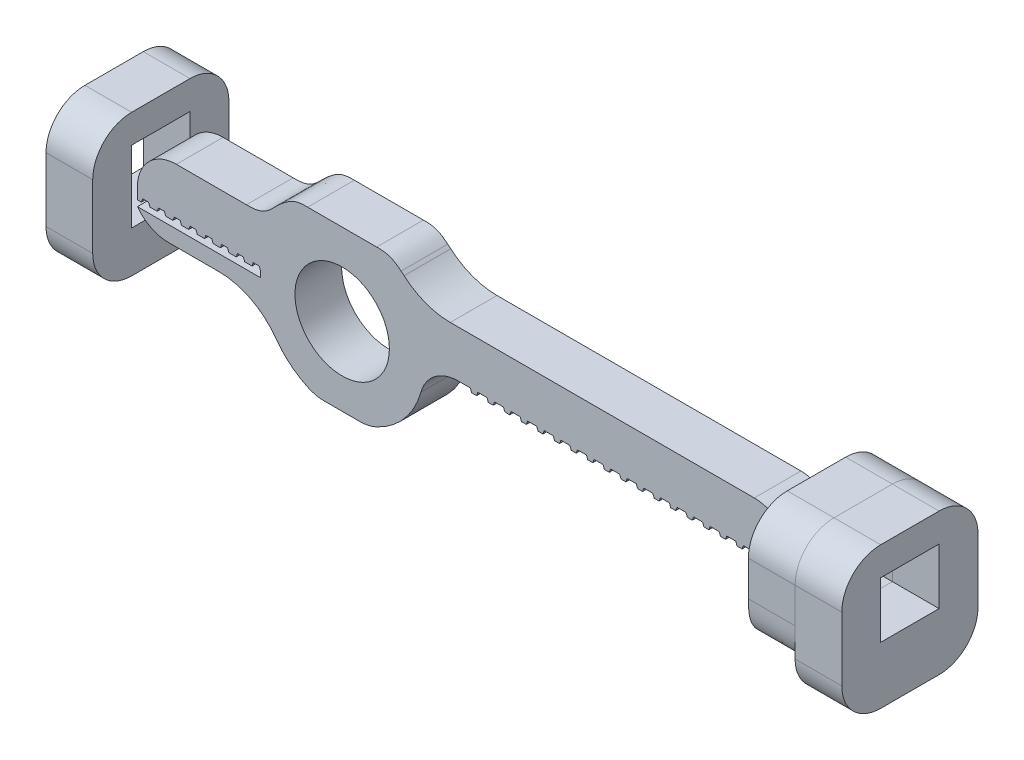
from build123d import *

# Parameters (mm, degrees)
SKETCH1_R      = 6.065
EXTRUDE1_DEPTH = 6
FILLET2_DEPTH  = 6
FILLET3_START  = -1
FILLET3_DEPTH  = 8
FILLET4_START  = -1
FILLET4_DEPTH  = 8
FILLET5_R      = 5
FILLET6_R      = 9
SKETCH2_W      = 17.5
SKETCH2_H      = 14.52
SKETCH2_W_2    = 7.5
SKETCH2_H_2    = 7.19
EXTRUDE2_DEPTH = 6
FILLET7_R      = 5
FILLET8_SIZE   = 5
FILLET9_SIZE   = 5
SKETCH4_W      = 7.5
SKETCH4_H      = 7.19
EXTRUDE4_DEPTH = 6
FILLET10_R     = 5
FILLET11_R     = 5
EXTRUDE5_DEPTH = 6


with BuildPart() as part:
    # Sketch1 → Extrude1 (new body)
    with BuildSketch(Plane.XY):
        with BuildLine():
            Line((-10.493301435, -0.375), (-26.29815405, -0.375))
            Line((-26.29815405, -0.375), (-26.29815405, -2.375))
            Line((-26.29815405, -2.375), (-10.227872457, -2.375))
            ThreePointArc((-10.227872457, -2.375), (-7.721566195, -7.115294477), (-3.201562119, -10))
            Line((-3.201562119, -10), (3.201562119, -10))
            ThreePointArc((3.201562119, -10), (8.720950005, -5.847651752), (10.466746152, 0.835))
            Line((10.466746152, 0.835), (16.466746152, 0.835))
            Line((16.466746152, 0.835), (16.634172459, 0.375))
            Line((16.634172459, 0.375), (17.269319844, 0.375))
            Line((17.269319844, 0.375), (17.436746152, 0.835))
            Line((17.436746152, 0.835), (18.598246152, 0.835))
            Line((18.598246152, 0.835), (18.765672459, 0.375))
            Line((18.765672459, 0.375), (19.400819844, 0.375))
            Line((19.400819844, 0.375), (19.568246152, 0.835))
            Line((19.568246152, 0.835), (20.729746152, 0.835))
            Line((20.729746152, 0.835), (20.897172459, 0.375))
            Line((20.897172459, 0.375), (21.532319844, 0.375))
            Line((21.532319844, 0.375), (21.699746152, 0.835))
            Line((21.699746152, 0.835), (22.861246152, 0.835))
            Line((22.861246152, 0.835), (23.028672459, 0.375))
            Line((23.028672459, 0.375), (23.663819844, 0.375))
            Line((23.663819844, 0.375), (23.831246152, 0.835))
            Line((23.831246152, 0.835), (24.992746152, 0.835))
            Line((24.992746152, 0.835), (25.160172459, 0.375))
            Line((25.160172459, 0.375), (25.795319844, 0.375))
            Line((25.795319844, 0.375), (25.962746152, 0.835))
            Line((25.962746152, 0.835), (27.124246152, 0.835))
            Line((27.124246152, 0.835), (27.291672459, 0.375))
            Line((27.291672459, 0.375), (27.926819844, 0.375))
            Line((27.926819844, 0.375), (28.094246152, 0.835))
            Line((28.094246152, 0.835), (29.255746152, 0.835))
            Line((29.255746152, 0.835), (29.423172459, 0.375))
            Line((29.423172459, 0.375), (30.058319844, 0.375))
            Line((30.058319844, 0.375), (30.225746152, 0.835))
            Line((30.225746152, 0.835), (31.387246152, 0.835))
            Line((31.387246152, 0.835), (31.554672459, 0.375))
            Line((31.554672459, 0.375), (32.189819844, 0.375))
            Line((32.189819844, 0.375), (32.357246152, 0.835))
            Line((32.357246152, 0.835), (33.518746152, 0.835))
            Line((33.518746152, 0.835), (33.686172459, 0.375))
            Line((33.686172459, 0.375), (34.321319844, 0.375))
            Line((34.321319844, 0.375), (34.488746152, 0.835))
            Line((34.488746152, 0.835), (35.650246152, 0.835))
            Line((35.650246152, 0.835), (35.817672459, 0.375))
            Line((35.817672459, 0.375), (36.452819844, 0.375))
            Line((36.452819844, 0.375), (36.620246152, 0.835))
            Line((36.620246152, 0.835), (37.781746152, 0.835))
            Line((37.781746152, 0.835), (37.949172459, 0.375))
            Line((37.949172459, 0.375), (38.584319844, 0.375))
            Line((38.584319844, 0.375), (38.751746152, 0.835))
            Line((38.751746152, 0.835), (39.913246152, 0.835))
            Line((39.913246152, 0.835), (40.080672459, 0.375))
            Line((40.080672459, 0.375), (40.715819844, 0.375))
            Line((40.715819844, 0.375), (40.883246152, 0.835))
            Line((40.883246152, 0.835), (42.044746152, 0.835))
            Line((42.044746152, 0.835), (42.212172459, 0.375))
            Line((42.212172459, 0.375), (42.847319844, 0.375))
            Line((42.847319844, 0.375), (43.014746152, 0.835))
            Line((43.014746152, 0.835), (44.176246152, 0.835))
            Line((44.176246152, 0.835), (44.343672459, 0.375))
            Line((44.343672459, 0.375), (44.978819844, 0.375))
            Line((44.978819844, 0.375), (45.146246152, 0.835))
            Line((45.146246152, 0.835), (46.307746152, 0.835))
            Line((46.307746152, 0.835), (46.475172459, 0.375))
            Line((46.475172459, 0.375), (47.110319844, 0.375))
            Line((47.110319844, 0.375), (47.277746152, 0.835))
            Line((47.277746152, 0.835), (48.439246152, 0.835))
            Line((48.439246152, 0.835), (48.606672459, 0.375))
            Line((48.606672459, 0.375), (49.241819844, 0.375))
            Line((49.241819844, 0.375), (49.409246152, 0.835))
            Line((49.409246152, 0.835), (50.570746152, 0.835))
            Line((50.570746152, 0.835), (50.738172459, 0.375))
            Line((50.738172459, 0.375), (51.373319844, 0.375))
            Line((51.373319844, 0.375), (51.540746152, 0.835))
            Line((51.540746152, 0.835), (52.702246152, 0.835))
            Line((52.702246152, 0.835), (52.869672459, 0.375))
            Line((52.869672459, 0.375), (53.504819844, 0.375))
            Line((53.504819844, 0.375), (53.672246152, 0.835))
            Line((53.672246152, 0.835), (54.833746152, 0.835))
            Line((54.833746152, 0.835), (55.001172459, 0.375))
            Line((55.001172459, 0.375), (55.636319844, 0.375))
            Line((55.636319844, 0.375), (55.803746152, 0.835))
            Line((55.803746152, 0.835), (56.965246152, 0.835))
            Line((56.965246152, 0.835), (57.132672459, 0.375))
            Line((57.132672459, 0.375), (57.767819844, 0.375))
            Line((57.767819844, 0.375), (57.935246152, 0.835))
            Line((57.935246152, 0.835), (57.935246152, 6.835))
            Line((57.935246152, 6.835), (9.942182859, 6.835))
            ThreePointArc((9.942182859, 6.835), (8.151040277, 8.895210363), (5.942577303, 10.5))
            Line((5.942577303, 10.5), (-5.942577303, 10.5))
            ThreePointArc((-5.942577303, 10.5), (-8.151040277, 8.895210363), (-9.942182859, 6.835))
            Line((-9.942182859, 6.835), (-26.29815405, 6.835))
            Line((-26.29815405, 6.835), (-26.29815405, 0.375))
            Line((-26.29815405, 0.375), (-25.79815405, 0.375))
            Line((-25.79815405, 0.375), (-25.630727742, 0.835))
            Line((-25.630727742, 0.835), (-24.870727742, 0.835))
            Line((-24.870727742, 0.835), (-24.703301435, 0.375))
            Line((-24.703301435, 0.375), (-23.76815405, 0.375))
            Line((-23.76815405, 0.375), (-23.600727742, 0.835))
            Line((-23.600727742, 0.835), (-22.840727742, 0.835))
            Line((-22.840727742, 0.835), (-22.673301435, 0.375))
            Line((-22.673301435, 0.375), (-21.73815405, 0.375))
            Line((-21.73815405, 0.375), (-21.570727742, 0.835))
            Line((-21.570727742, 0.835), (-20.810727742, 0.835))
            Line((-20.810727742, 0.835), (-20.643301435, 0.375))
            Line((-20.643301435, 0.375), (-19.70815405, 0.375))
            Line((-19.70815405, 0.375), (-19.540727742, 0.835))
            Line((-19.540727742, 0.835), (-18.780727742, 0.835))
            Line((-18.780727742, 0.835), (-18.613301435, 0.375))
            Line((-18.613301435, 0.375), (-17.67815405, 0.375))
            Line((-17.67815405, 0.375), (-17.510727742, 0.835))
            Line((-17.510727742, 0.835), (-16.750727742, 0.835))
            Line((-16.750727742, 0.835), (-16.583301435, 0.375))
            Line((-16.583301435, 0.375), (-15.64815405, 0.375))
            Line((-15.64815405, 0.375), (-15.480727742, 0.835))
            Line((-15.480727742, 0.835), (-14.720727742, 0.835))
            Line((-14.720727742, 0.835), (-14.553301435, 0.375))
            Line((-14.553301435, 0.375), (-13.61815405, 0.375))
            Line((-13.61815405, 0.375), (-13.450727742, 0.835))
            Line((-13.450727742, 0.835), (-12.690727742, 0.835))
            Line((-12.690727742, 0.835), (-12.523301435, 0.375))
            Line((-12.523301435, 0.375), (-11.58815405, 0.375))
            Line((-11.58815405, 0.375), (-11.420727742, 0.835))
            Line((-11.420727742, 0.835), (-10.660727742, 0.835))
            Line((-10.660727742, 0.835), (-10.493301435, 0.375))
            Line((-10.493301435, 0.375), (-10.493301435, -0.375))
        make_face()
        Circle(SKETCH1_R, mode=Mode.SUBTRACT)
    extrude(amount=EXTRUDE1_DEPTH)

    # Fillet2: read off the stored shape, not the designer's step
    # Fillet2 outline → Fillet2 (add)
    with BuildSketch(Plane.XY):
        with BuildLine():
            add(Edge.make_bspline(
                [(-12.294185618, 6.835), (-11.905313894, 6.835), (-11.516442171, 6.835), (-10.67655072, 6.906172482), (-9.881403513, 7.220513356), (-9.165463466, 7.859034763), (-8.922720644, 8.127726336), (-8.692021651, 8.367376209)],
                knots=[0, 0, 0, 0, 0, 0, 0.5, 0.5, 1, 1, 1, 1, 1, 1], degree=5))
            Line((-12.294185618, 6.835), (-9.942182859, 6.835))
            ThreePointArc((-9.942182859, 6.835), (-9.348552757, 7.626846423), (-8.692021651, 8.367376209))
        make_face()
    extrude(amount=FILLET2_DEPTH)

    # Fillet3: read off the stored shape, not the designer's step
    # Fillet3 outline → Fillet3 (cut)
    with BuildSketch(Plane.XY.offset(FILLET3_START)):
        with BuildLine():
            Line((3, 10.5), (4.434436266, 10.5))
            add(Edge.make_bspline(
                [(4.434436266, 10.5), (4.759474434, 10.5), (5.084512601, 10.5), (5.829579536, 10.443931897), (6.468104214, 10.209741168), (7.011187199, 9.828881322), (7.300205983, 9.612168516), (7.572749264, 9.392427459)],
                knots=[0, 0, 0, 0, 0, 0, 0.5, 0.5, 1, 1, 1, 1, 1, 1], degree=5))
            ThreePointArc((7.572749264, 9.392427459), (7.78846806, 9.214336128), (8, 9.031291436))
            Line((8, 9.031291436), (8, 12))
            Line((8, 12), (3, 12))
            Line((3, 12), (3, 10.5))
        make_face()
    extrude(amount=FILLET3_DEPTH, mode=Mode.SUBTRACT)

    # Fillet4: read off the stored shape, not the designer's step
    # Fillet4 outline → Fillet4 (cut)
    with BuildSketch(Plane.XY.offset(FILLET4_START)):
        with BuildLine():
            ThreePointArc((-8, 9.031291436), (-7.78846806, 9.214336128), (-7.572749264, 9.392427459))
            add(Edge.make_bspline(
                [(-7.572749264, 9.392427459), (-7.300205983, 9.612168516), (-7.011187199, 9.828881323), (-6.468104214, 10.209741168), (-5.829579536, 10.443931897), (-5.084512601, 10.5), (-4.759474434, 10.5), (-4.434436266, 10.5)],
                knots=[0, 0, 0, 0, 0, 0, 0.5, 0.5, 1, 1, 1, 1, 1, 1], degree=5))
            Line((-4.434436266, 10.5), (-3, 10.5))
            Line((-3, 10.5), (-3, 12))
            Line((-3, 12), (-8, 12))
            Line((-8, 12), (-8, 9.031291436))
        make_face()
    extrude(amount=FILLET4_DEPTH, mode=Mode.SUBTRACT)

    # Fillet5
    fillet5_edges = [part.edges().sort_by_distance(p)[0] for p in [
        (3.201562119, -10, 3),
        (-3.201562119, -10, 3),
    ]]
    fillet(fillet5_edges, radius=FILLET5_R)

    # Fillet6
    fillet6_edges = [part.edges().sort_by_distance(p)[0] for p in [
        (9.942182859, 6.835, 3),
        (-10.227872457, -2.375, 3),
    ]]
    fillet(fillet6_edges, radius=FILLET6_R)

    # Fillet11
    # the kernel refuses this fillet: 5 mm, written as the material it adds along each edge
    with BuildSketch(Plane(origin=(10.466746152, 0.835, 0), x_dir=(-0.09607424532999272, -0.9953741705430538, 0), z_dir=(0, 0, 1))) as fillet11_piece_1:
        with BuildLine():
            CenterArc((4.548073945, 4.922907988), FILLET11_R, 185.513152369, 74.412500436)
            Line((-0.428796908, 4.442536761), (0, 0))
            ThreePointArc((0, 0), (1.83672217, 0.161893226), (3.67344434, 0))
        make_face()
    extrude(amount=6)
    # the kernel refuses this fillet: 5 mm, written as the material it takes off along each edge
    with BuildSketch(Plane(origin=(-26.29815405, -2.375, -10), x_dir=(1, 0, 0), z_dir=(0, 0, 1))) as fillet11_2_piece_1:
        with BuildLine():
            CenterArc((4, 5), FILLET11_R, 216.869897646, 53.130102354)
            Line((0, 2), (0, 0))
            Line((0, 0), (4, 0))
        make_face()
    extrude(amount=26, mode=Mode.SUBTRACT)
    with BuildSketch(Plane(origin=(-26.29815405, 6.835, -12.5), x_dir=(0, -1, 0), z_dir=(0, 0, 1)), Plane(origin=(57.935246152, 6.835, -12.5), x_dir=(-1, 0, 0), z_dir=(0, 0, 1))) as fillet11_2_piece_2:
        with BuildLine():
            CenterArc((FILLET11_R, FILLET11_R), FILLET11_R, 180, 90)
            Line((0, FILLET11_R), (0, 0))
            Line((0, 0), (FILLET11_R, 0))
        make_face()
    extrude(amount=31, mode=Mode.SUBTRACT)


with BuildPart() as body_2:
    # Sketch2 → Extrude2 (new body)
    with BuildSketch(Plane(origin=(57.935246152, 0, 0), x_dir=(0, 0, -1), z_dir=(1, 0, 0))):
        with Locations((-3, 3.24)):
            Rectangle(SKETCH2_W, SKETCH2_H)
        with Locations((-3, 3.24)):
            Rectangle(SKETCH2_W_2, SKETCH2_H_2, mode=Mode.SUBTRACT)
    extrude(amount=EXTRUDE2_DEPTH)

    # Fillet7
    fillet7_edges = [body_2.edges().sort_by_distance(p)[0] for p in [
        (60.935246152, 10.5, 11.75),
        (60.935246152, 10.5, -5.75),
    ]]
    fillet(fillet7_edges, radius=FILLET7_R)

    # Fillet8
    # a fillet whose section is not a circle: 5 mm, written as the material it takes off along each edge
    with BuildSketch(Plane(origin=(45.435246152, -4.02, 11.75), x_dir=(0, 1, 0), z_dir=(1, 0, 0))) as fillet8_piece_1:
        with BuildLine():
            add(Edge.make_bspline([(FILLET8_SIZE, 0), (FILLET8_SIZE * 0.831801948466, 0), (FILLET8_SIZE * 0.663603896932, 0), (FILLET8_SIZE * 0.292893218813, -FILLET8_SIZE * 0.0716919198361), (FILLET8_SIZE * 0.0716919198361, -FILLET8_SIZE * 0.292893218813), (0, -FILLET8_SIZE * 0.663603896932), (0, -FILLET8_SIZE * 0.831801948466), (0, -FILLET8_SIZE)], knots=[0, 0, 0, 0, 0, 0, 0.5, 0.5, 1, 1, 1, 1, 1, 1], degree=5))
            Line((0, -FILLET8_SIZE), (0, 0))
            Line((0, 0), (FILLET8_SIZE, 0))
        make_face()
    extrude(amount=31, mode=Mode.SUBTRACT)

    # Fillet9
    # a fillet whose section is not a circle: 5 mm, written as the material it takes off along each edge
    with BuildSketch(Plane(origin=(45.435246152, -4.02, -5.75), x_dir=(0, 0, 1), z_dir=(1, 0, 0))) as fillet9_piece_1:
        with BuildLine():
            add(Edge.make_bspline([(FILLET9_SIZE, 0), (FILLET9_SIZE * 0.831801948466, 0), (FILLET9_SIZE * 0.663603896932, 0), (FILLET9_SIZE * 0.292893218813, -FILLET9_SIZE * 0.0716919198361), (FILLET9_SIZE * 0.0716919198361, -FILLET9_SIZE * 0.292893218813), (0, -FILLET9_SIZE * 0.663603896932), (0, -FILLET9_SIZE * 0.831801948466), (0, -FILLET9_SIZE)], knots=[0, 0, 0, 0, 0, 0, 0.5, 0.5, 1, 1, 1, 1, 1, 1], degree=5))
            Line((0, -FILLET9_SIZE), (0, 0))
            Line((0, 0), (FILLET9_SIZE, 0))
        make_face()
    extrude(amount=31, mode=Mode.SUBTRACT)


with BuildPart() as body_3:
    # Sketch4 → Extrude4 (new body)
    with BuildSketch(Plane(origin=(63.935246152, 0, 0), x_dir=(0, 0, -1), z_dir=(1, 0, 0))):
        with BuildLine():
            Line((-6.75, 10.5), (0.75, 10.5))
            ThreePointArc((0.75, 10.5), (4.285533906, 9.035533906), (5.75, 5.5))
            Line((5.75, 5.5), (5.75, -7.707743543))
            Line((5.75, -7.707743543), (-11.75, -7.707743543))
            Line((-11.75, -7.707743543), (-11.75, 5.5))
            ThreePointArc((-11.75, 5.5), (-10.285533906, 9.035533906), (-6.75, 10.5))
        make_face()
        with Locations((-3, 3.24)):
            Rectangle(SKETCH4_W, SKETCH4_H, mode=Mode.SUBTRACT)
    extrude(amount=EXTRUDE4_DEPTH)

    # Fillet10
    fillet10_edges = [body_3.edges().sort_by_distance(p)[0] for p in [
        (66.935246152, -7.707743543, -5.75),
        (66.935246152, -7.707743543, 11.75),
    ]]
    fillet(fillet10_edges, radius=FILLET10_R)


with BuildPart() as body_4:
    # Sketch5 → Extrude5 (new body)
    with BuildSketch(Plane.ZY.offset(26.29815405)):
        with BuildLine():
            Line((-5.75, 5.5), (-5.75, -2.707743543))
            ThreePointArc((-5.75, -2.707743543), (-4.285533906, -6.243277449), (-0.75, -7.707743543))
            Line((-0.75, -7.707743543), (6.75, -7.707743543))
            ThreePointArc((6.75, -7.707743543), (10.285533906, -6.243277449), (11.75, -2.707743543))
            Line((11.75, -2.707743543), (11.75, 5.5))
            ThreePointArc((11.75, 5.5), (10.285533906, 9.035533906), (6.75, 10.5))
            Line((6.75, 10.5), (-0.75, 10.5))
            ThreePointArc((-0.75, 10.5), (-4.285533906, 9.035533906), (-5.75, 5.5))
        make_face()
        Polygon((-0.75, -0.355), (-0.75, 6.835), (6.75, 6.835), (6.75, -0.355), (6.75, -2.376), (-0.75, -2.376), align=None, mode=Mode.SUBTRACT)
    extrude(amount=EXTRUDE5_DEPTH)


solid = Compound([part.part, body_2.part, body_3.part, body_4.part])
